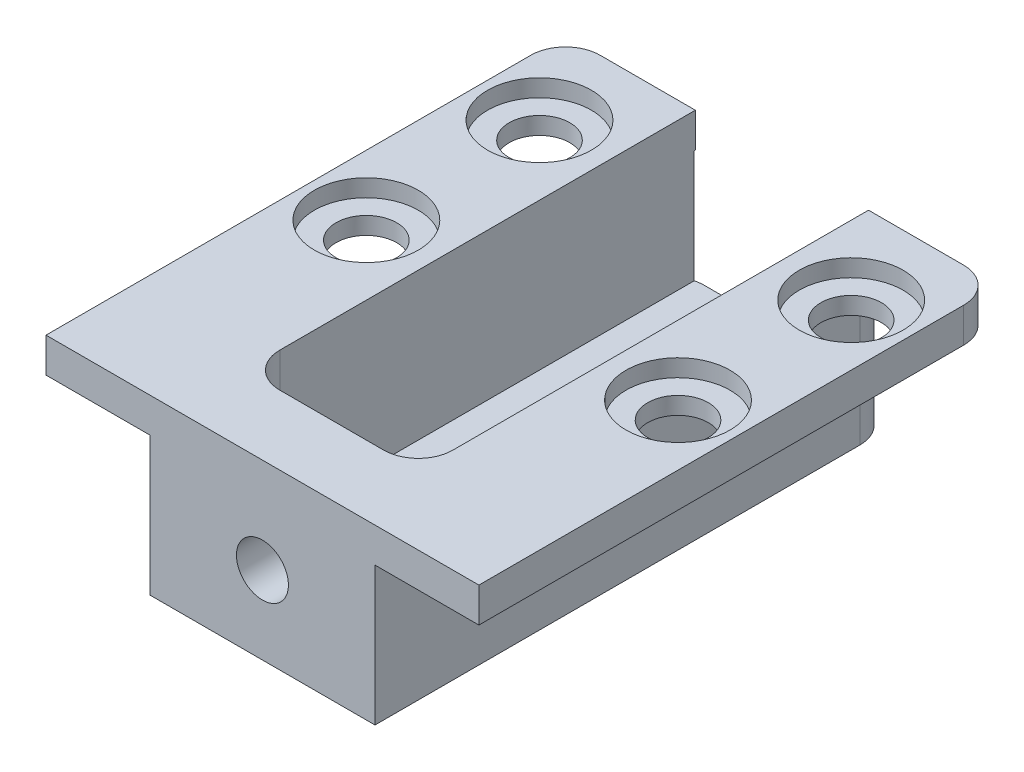
from build123d import *

# Parameters (mm, degrees)
SKETCH_1_W           = 35
SKETCH_1_H           = 55
EXTRUDE_1_DEPTH      = 1
EXTRUDE_2_DEPTH      = 3
SKETCH_3_R           = 5
CUT_EXTRUDE_1_DEPTH  = 169.569903897
SKETCH_4_R           = 4
CUT_EXTRUDE_2_DEPTH  = 2
SKETCH_5_R           = 2
CUT_EXTRUDE_3_DEPTH  = 2
EXTRUDE_START        = 7
EXTRUDE_3_DEPTH      = 7
CUT_EXTRUDE_START    = -1.5
SKETCH_9_W           = 10
SKETCH_9_H           = 26
CUT_EXTRUDE_4_DEPTH  = 168.318874833
SKETCH_10_R          = 1.5
CUT_EXTRUDE_5_DEPTH  = 194.595583627
SKETCH_11_W          = 338.377402865
SKETCH_11_H          = 318.232792562
CUT_EXTRUDE_6_DEPTH  = 10
SKETCH_12_W          = 33.023791835
SKETCH_12_H          = 7.5
CUT_EXTRUDE_7_DEPTH  = 74.963673636
CUT_EXTRUDE_START_2  = 9
CUT_EXTRUDE_8_DEPTH  = 10
EXTRUDE_START_2      = -2
EXTRUDE_4_DEPTH      = 2
EXTRUDE_5_DEPTH      = 8
SKETCH_16_R          = 1.5
CUT_EXTRUDE_9_DEPTH  = 53.962840747
SKETCH_17_R          = 1.75
CUT_EXTRUDE_10_DEPTH = 10
SKETCH_18_R          = 3
CUT_EXTRUDE_11_DEPTH = 1
FILLET_1_R           = 2
FILLET_2_R           = 2
FILLET_3_R           = 2
FILLET_4_R           = 2


with BuildPart() as part:
    # 草图1 → 凸台-拉伸1 (new body)
    with BuildSketch(Plane(origin=(0, 0, 0), x_dir=(1, 0, 0), z_dir=(0, 1, 0))):
        Rectangle(SKETCH_1_W, SKETCH_1_H)
    extrude(amount=EXTRUDE_1_DEPTH)

    # 草图2 → 凸台-拉伸2 (add)
    with BuildSketch(Plane(origin=(0, 1, 0), x_dir=(1, 0, 0), z_dir=(0, 1, 0))):
        with BuildLine():
            Line((106.75, -2.25), (106.75, 2.25))
            Line((106.75, 2.25), (121.75, 2.25))
            ThreePointArc((121.75, 2.25), (122.922125199, 2.352547667), (124.058635967, 2.65707481))
            Line((124.058635967, 2.65707481), (154.058635967, 13.576181838))
            ThreePointArc((154.058635967, 13.576181838), (158.397452333, 21.091232227), (151.75, 26.669107028))
            Line((151.75, 26.669107028), (-31.447415548, 57.101298968))
            ThreePointArc((-31.447415548, 57.101298968), (-37.800418235, 56.264673928), (-42.609265279, 52.029632639))
            Line((-42.609265279, 52.029632639), (-60.161792173, 23.605896086))
            ThreePointArc((-60.161792173, 23.605896086), (-61.717833724, 20.073278016), (-62.25, 16.25))
            Line((-62.25, 16.25), (-62.25, -16.25))
            ThreePointArc((-62.25, -16.25), (-61.717833724, -20.073278016), (-60.161792173, -23.605896086))
            Line((-60.161792173, -23.605896086), (-42.609265279, -52.029632639))
            ThreePointArc((-42.609265279, -52.029632639), (-37.800418235, -56.264673928), (-31.447415548, -57.101298968))
            Line((-31.447415548, -57.101298968), (151.75, -26.669107028))
            ThreePointArc((151.75, -26.669107028), (158.397452333, -21.091232227), (154.058635967, -13.576181838))
            Line((154.058635967, -13.576181838), (124.058635967, -2.65707481))
            ThreePointArc((124.058635967, -2.65707481), (122.922125199, -2.352547667), (121.75, -2.25))
            Line((121.75, -2.25), (106.75, -2.25))
        make_face()
    extrude(amount=EXTRUDE_2_DEPTH)

    # 草图3 → 切除-拉伸1 (cut, through all)
    with BuildSketch(Plane(origin=(0, 4, 0), x_dir=(1, 0, 0), z_dir=(0, 1, 0))):
        with Locations(Location((-48.25, 16.25, 0), (0, 0, 270))):
            Circle(SKETCH_3_R)
        with Locations(Location((-48.25, -16.25, 0), (0, 0, 270))):
            Circle(SKETCH_3_R)
    extrude(amount=-CUT_EXTRUDE_1_DEPTH, mode=Mode.SUBTRACT)

    # 草图4 → 切除-拉伸2 (cut)
    with BuildSketch(Plane(origin=(0, 4, 0), x_dir=(1, 0, 0), z_dir=(0, 1, 0))):
        with Locations(Location((-33.25, 46.25, 0), (0, 0, 270))):
            Circle(SKETCH_4_R)
        with Locations(Location((-33.25, -46.25, 0), (0, 0, 270))):
            Circle(SKETCH_4_R)
    extrude(amount=-CUT_EXTRUDE_2_DEPTH, mode=Mode.SUBTRACT)

    # 草图5 → 切除-拉伸3 (cut)
    with BuildSketch(Plane(origin=(0, 4, 0), x_dir=(1, 0, 0), z_dir=(0, 1, 0))):
        with Locations(Location((121.75, 9, 0), (0, 0, 270))):
            Circle(SKETCH_5_R)
        with Locations(Location((121.75, -9, 0), (0, 0, 270))):
            Circle(SKETCH_5_R)
        with Locations(Location((151.75, 19.919107028, 0), (0, 0, 270))):
            Circle(SKETCH_5_R)
        with Locations(Location((151.75, -19.919107028, 0), (0, 0, 270))):
            Circle(SKETCH_5_R)
    extrude(amount=-CUT_EXTRUDE_3_DEPTH, mode=Mode.SUBTRACT)

    # 草图8 → 凸台-拉伸3 (add)
    with BuildSketch(Plane.XZ.offset(-1).offset(EXTRUDE_START)):
        with BuildLine():
            Line((-26.75, -26.25), (-39.75, -26.25))
            Line((-39.75, -26.25), (-39.75, -55.124119675))
            ThreePointArc((-39.75, -55.124119675), (-35.798281322, -56.950759894), (-31.447415548, -57.101298968))
            Line((-31.447415548, -57.101298968), (-26.75, -56.320978726))
            Line((-26.75, -56.320978726), (-26.75, -26.25))
        make_face()
    extrude_3 = extrude(amount=-EXTRUDE_3_DEPTH)

    # 镜向1: 凸台-拉伸3 across plane
    add(extrude_3.mirror(Plane.XY))

    # 草图9 → 切除-拉伸4 (cut, through all)
    with BuildSketch(Plane.XZ.offset(6).offset(CUT_EXTRUDE_START)):
        with Locations((-33.25, -40.75)):
            Rectangle(SKETCH_9_W, SKETCH_9_H)
    cut_extrude_4 = extrude(amount=-CUT_EXTRUDE_4_DEPTH, mode=Mode.SUBTRACT)

    # 镜向2: 切除-拉伸4 across plane
    add(cut_extrude_4.mirror(Plane.XY), mode=Mode.SUBTRACT)

    # 草图10 → 切除-拉伸5 (cut, through all)
    with BuildSketch(Plane.XY.offset(-53.75)):
        with Locations((-33.25, -1.5)):
            Circle(SKETCH_10_R)
    cut_extrude_5 = extrude(amount=-CUT_EXTRUDE_5_DEPTH, mode=Mode.SUBTRACT)

    # 镜向3: 切除-拉伸5 across plane
    add(cut_extrude_5.mirror(Plane.XY), mode=Mode.SUBTRACT)

    # 草图11 → 切除-拉伸6 (cut)
    with BuildSketch(Plane.XZ.offset(6)):
        with Locations((33.683140033, 0)):
            Rectangle(SKETCH_11_W, SKETCH_11_H)
        with BuildLine():
            ThreePointArc((-30.464187664, 63.020189314), (-38.770685795, 62.328620225), (-45.75, 57.771718622))
            Line((-45.75, 57.771718622), (-45.75, 20.25))
            Line((-45.75, 20.25), (-20.75, 20.25))
            Line((-20.75, 20.25), (-20.75, 61.406498299))
            Line((-20.75, 61.406498299), (-30.464187664, 63.020189314))
        make_face(mode=Mode.SUBTRACT)
    extrude(amount=-CUT_EXTRUDE_6_DEPTH, mode=Mode.SUBTRACT)

    # 草图12 → 切除-拉伸7 (cut, through all)
    with BuildSketch(Plane(origin=(0, 4, 0), x_dir=(1, 0, 0), z_dir=(0, 1, 0))):
        with Locations((-37.261895917, -24)):
            Rectangle(SKETCH_12_W, SKETCH_12_H)
    extrude(amount=-CUT_EXTRUDE_7_DEPTH, mode=Mode.SUBTRACT)

    # 草图13 → 切除-拉伸8 (cut)
    with BuildSketch(Plane.XZ.offset(-1).offset(CUT_EXTRUDE_START_2)):
        Polygon((-26.75, 56.320978726), (-26.75, 27.75), (-20.75, 27.75), (-20.75, 55.324277157), align=None)
        with BuildLine():
            Line((-45.75, 46.943674541), (-45.75, 27.75))
            Line((-45.75, 27.75), (-39.75, 27.75))
            Line((-39.75, 27.75), (-39.75, 55.124119675))
            ThreePointArc((-39.75, 55.124119675), (-41.329172996, 53.715049478), (-42.609265279, 52.029632639))
            Line((-42.609265279, 52.029632639), (-45.75, 46.943674541))
        make_face()
    extrude(amount=-CUT_EXTRUDE_8_DEPTH, mode=Mode.SUBTRACT)

    # 草图14 → 凸台-拉伸4 (add)
    with BuildSketch(Plane(origin=(0, 4, 0), x_dir=(1, 0, 0), z_dir=(0, 1, 0)).offset(EXTRUDE_START_2)):
        with BuildLine():
            Line((-38.25, -53.75), (-38.25, -27.75))
            Line((-38.25, -27.75), (-45.75, -27.75))
            Line((-45.75, -27.75), (-45.75, -46.943674541))
            Line((-45.75, -46.943674541), (-42.609265279, -52.029632639))
            ThreePointArc((-42.609265279, -52.029632639), (-37.800418235, -56.264673928), (-31.447415548, -57.101298968))
            Line((-31.447415548, -57.101298968), (-20.75, -55.324277157))
            Line((-20.75, -55.324277157), (-20.75, -27.75))
            Line((-20.75, -27.75), (-28.25, -27.75))
            Line((-28.25, -27.75), (-28.25, -53.75))
            Line((-28.25, -53.75), (-38.25, -53.75))
        make_face()
        with BuildLine():
            Line((-20.75, -57.75), (-20.75, -55.324277157))
            Line((-20.75, -55.324277157), (-31.447415548, -57.101298968))
            ThreePointArc((-31.447415548, -57.101298968), (-37.800418235, -56.264673928), (-42.609265279, -52.029632639))
            Line((-42.609265279, -52.029632639), (-45.75, -46.943674541))
            Line((-45.75, -46.943674541), (-45.75, -57.75))
            Line((-45.75, -57.75), (-20.75, -57.75))
        make_face()
    extrude(amount=EXTRUDE_4_DEPTH)

    # 草图15 → 凸台-拉伸5 (add)
    with BuildSketch(Plane.XZ.offset(6)):
        with BuildLine():
            Line((-39.75, 55.124119675), (-39.75, 57.75))
            Line((-39.75, 57.75), (-26.75, 57.75))
            Line((-26.75, 57.75), (-26.75, 56.320978726))
            Line((-26.75, 56.320978726), (-31.447415548, 57.101298968))
            ThreePointArc((-31.447415548, 57.101298968), (-35.798281322, 56.950759894), (-39.75, 55.124119675))
        make_face()
    extrude(amount=-EXTRUDE_5_DEPTH)

    # 草图16 → 切除-拉伸9 (cut, through all)
    with BuildSketch(Plane(origin=(0, 0, 53.75), x_dir=(-1, 0, 0), z_dir=(0, 0, -1))):
        with Locations((33.25, -1.5)):
            Circle(SKETCH_16_R)
    extrude(amount=-CUT_EXTRUDE_9_DEPTH, mode=Mode.SUBTRACT)

    # 草图17 → 切除-拉伸10 (cut)
    with BuildSketch(Plane(origin=(0, 4, 0), x_dir=(1, 0, 0), z_dir=(0, 1, 0))):
        with Locations(Location((-24.25, -32.75, 0), (0, 0, 270))):
            Circle(SKETCH_17_R)
        with Locations(Location((-24.25, -42.75, 0), (0, 0, 270))):
            Circle(SKETCH_17_R)
        with Locations(Location((-42.25, -42.75, 0), (0, 0, 270))):
            Circle(SKETCH_17_R)
        with Locations(Location((-42.25, -32.75, 0), (0, 0, 270))):
            Circle(SKETCH_17_R)
    extrude(amount=-CUT_EXTRUDE_10_DEPTH, mode=Mode.SUBTRACT)

    # 草图18 → 切除-拉伸11 (cut)
    with BuildSketch(Plane(origin=(0, 4, 0), x_dir=(1, 0, 0), z_dir=(0, 1, 0))):
        with Locations(Location((-42.25, -32.75, 0), (0, 0, 270))):
            Circle(SKETCH_18_R)
        with Locations(Location((-24.25, -32.75, 0), (0, 0, 270))):
            Circle(SKETCH_18_R)
        with Locations(Location((-24.25, -42.75, 0), (0, 0, 270))):
            Circle(SKETCH_18_R)
        with Locations(Location((-42.25, -42.75, 0), (0, 0, 270))):
            Circle(SKETCH_18_R)
    extrude(amount=-CUT_EXTRUDE_11_DEPTH, mode=Mode.SUBTRACT)

    # 圆角1
    # the kernel refuses this fillet: 2 mm, written as the material it takes off along each edge
    with BuildSketch(Plane(origin=(-39.75, 2, 27.75), x_dir=(1, 0, 0), z_dir=(0, -1, 0))) as fillet_1_piece_1:
        with BuildLine():
            CenterArc((FILLET_1_R, FILLET_1_R), FILLET_1_R, 180, 90)
            Line((0, FILLET_1_R), (0, 0))
            Line((0, 0), (FILLET_1_R, 0))
        make_face()
    extrude(amount=13, mode=Mode.SUBTRACT)

    # 圆角2
    fillet_2_edges = [part.edges().sort_by_distance(p)[0] for p in [
        (-45.75, 3, 27.75),
        (-20.75, 3, 27.75),
    ]]
    fillet(fillet_2_edges, radius=FILLET_2_R)

    # 圆角3
    # the kernel refuses this fillet: 2 mm, written as the material it takes off along each edge
    with BuildSketch(Plane(origin=(-26.75, -11, 27.75), x_dir=(-1, 0, 0), z_dir=(0, 1, 0))) as fillet_3_piece_1:
        with BuildLine():
            CenterArc((FILLET_3_R, FILLET_3_R), FILLET_3_R, 180, 90)
            Line((0, FILLET_3_R), (0, 0))
            Line((0, 0), (FILLET_3_R, 0))
        make_face()
    extrude(amount=13, mode=Mode.SUBTRACT)

    # 圆角4
    fillet_4_edges = [part.edges().sort_by_distance(p)[0] for p in [
        (-28.25, -0.25, 53.75),
        (-38.25, -0.25, 53.75),
    ]]
    fillet(fillet_4_edges, radius=FILLET_4_R)


solid = part.part
